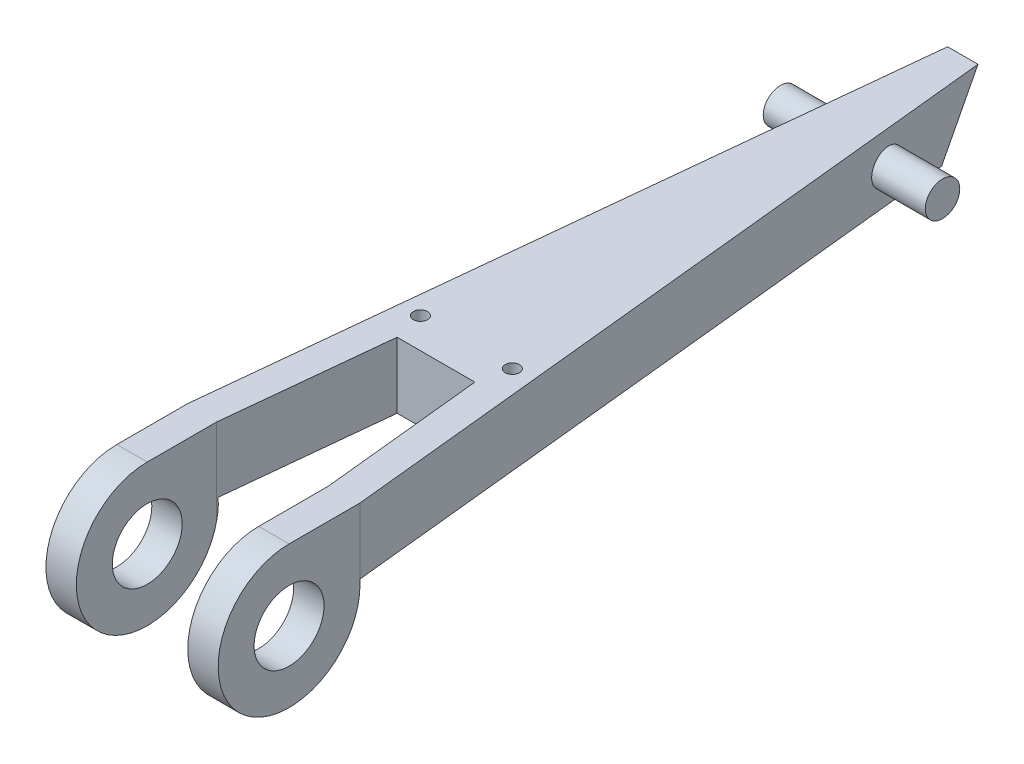
from build123d import *

# Parameters (mm, degrees)
SKETCH2_R               = 3.45
BOSS_EXTRUDE1_DEPTH     = 8.5
CUT_EXTRUDE1_DEPTH      = 79.819413852
CUT_EXTRUDE1_DEPTH_BACK = 79.819413852
SKETCH4_R               = 1.7
BOSS_EXTRUDE2_DEPTH     = 8
CUT_EXTRUDE2_DEPTH      = 80.701003758
CUT_EXTRUDE2_DEPTH_BACK = 80.701003758
SKETCH5_R               = 0.7


with BuildPart() as part:
    # Sketch2 → Boss-Extrude1 (new, symmetric)
    with BuildSketch(Plane(origin=(0, 0, 0), x_dir=(0, 0, -1), z_dir=(1, 0, 0))):
        with BuildLine():
            Line((0, 0), (4, 6.5))
            Line((4, 6.5), (-71, 6.5))
            ThreePointArc((-71, 6.5), (-75.769696007, -5.623475383), (-64.017879978, 0))
            Line((-64.017879978, 0), (0, 0))
        make_face()
        with Locations((-71, -0.5)):
            Circle(SKETCH2_R, mode=Mode.SUBTRACT)
    extrude(amount=BOSS_EXTRUDE1_DEPTH, both=True)

    # Sketch3 → Cut-Extrude1 (cut, two sides: drawn at the far end of the back side and taken through both)
    with BuildSketch(Plane.XZ.offset(-CUT_EXTRUDE1_DEPTH_BACK)):
        Polygon((-1.5, -4), (1.5, -4), (8.5, 64), (8.5, -8.908939415), (-8.5, -8.908939415), (-8.5, 64), align=None)
        Polygon((-5.5, 64.154004847), (-3.837087736, 48), (3.837087736, 48), (5.5, 64.154004847), (5.5, 78), (-5.5, 78), align=None)
    extrude(amount=CUT_EXTRUDE1_DEPTH + CUT_EXTRUDE1_DEPTH_BACK, mode=Mode.SUBTRACT)

    # Sketch4 → Boss-Extrude2 (add, symmetric)
    with BuildSketch(Plane(origin=(0, 0, 0), x_dir=(0, 0, -1), z_dir=(1, 0, 0))):
        with Locations((-6, 3.25)):
            Circle(SKETCH4_R)
    extrude(amount=BOSS_EXTRUDE2_DEPTH, both=True)

    # Sketch5 → Cut-Extrude2 (cut, two sides: drawn at the far end of the back side and taken through both)
    with BuildSketch(Plane(origin=(0, 6.5, 0), x_dir=(1, 0, 0), z_dir=(0, 1, 0)).offset(-CUT_EXTRUDE2_DEPTH_BACK)):
        with Locations((-4.533548687, -45)):
            Circle(SKETCH5_R)
        with Locations((4.533548687, -45)):
            Circle(SKETCH5_R)
    extrude(amount=CUT_EXTRUDE2_DEPTH + CUT_EXTRUDE2_DEPTH_BACK, mode=Mode.SUBTRACT)


solid = part.part
